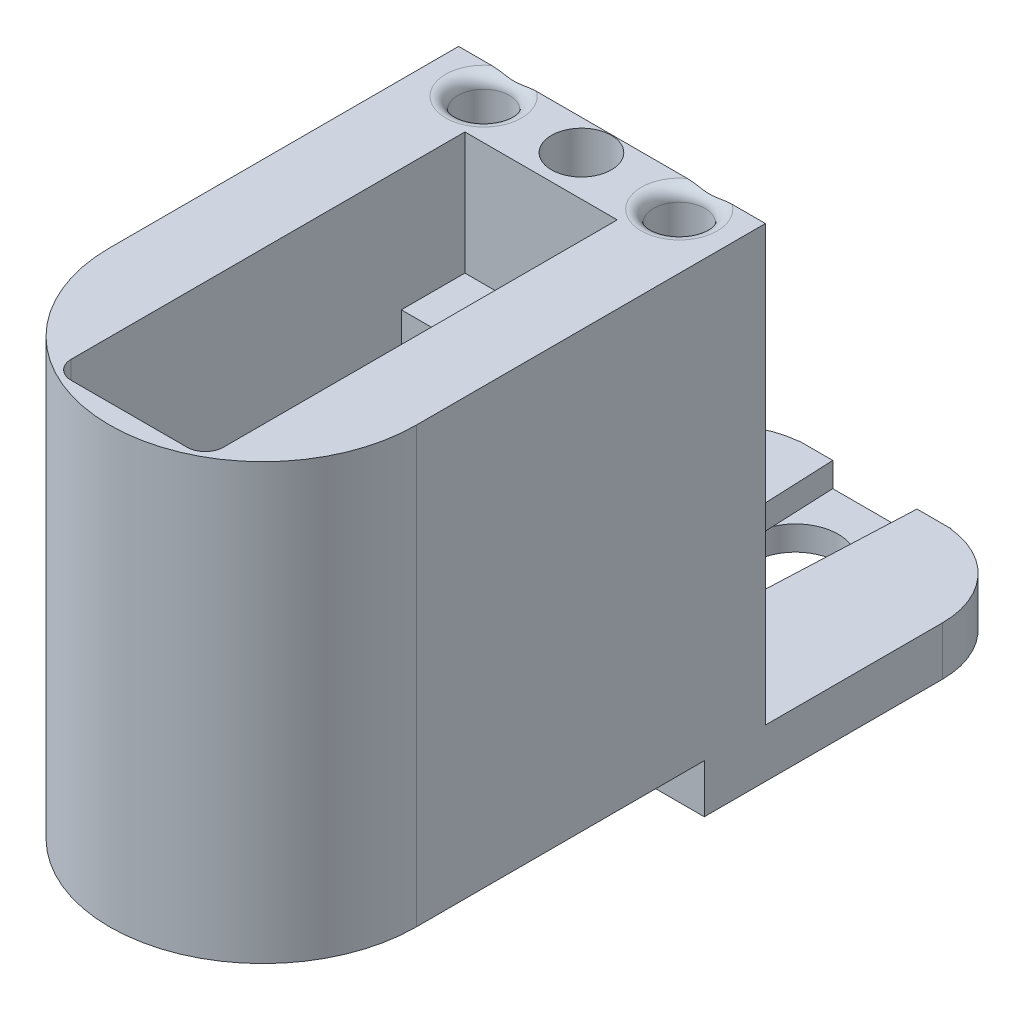
from build123d import *
from OCP.BRepFilletAPI import BRepFilletAPI_MakeChamfer

# Parameters (mm, degrees)
SKETCH4_W                = 12.46
SKETCH4_H                = 17.25
BOSS_EXTRUDE3_DEPTH      = 6
BOSS_EXTRUDE6_DEPTH      = 8.3
BOSS_EXTRUDE6_DEPTH_BACK = 17.25
SKETCH8_R                = 12.546781182
SKETCH8_R_2              = 11.15
BOSS_EXTRUDE4_DEPTH      = 17.25
SKETCH6_R                = 0.75
CUT_EXTRUDE1_DEPTH       = 5
CHAMFER1_SIZE            = 0.5
CHAMFER1_SIZE2           = 0.866025404
SKETCH10_W               = 12.46
SKETCH10_H               = 23.7
CUT_EXTRUDE3_DEPTH       = 17.25
BOSS_EXTRUDE7_START      = -8.3
BOSS_EXTRUDE7_DEPTH      = 8.3
BOSS_EXTRUDE9_START      = 10
BOSS_EXTRUDE9_DEPTH      = 10
BOSS_EXTRUDE11_START     = -8.3
SKETCH20_R               = 11.15
SKETCH20_R_2             = 7.15
BOSS_EXTRUDE11_DEPTH     = 8.3
CUT_EXTRUDE7_START       = -1.3
SKETCH21_R               = 10.15
SKETCH21_R_2             = 7.15
CUT_EXTRUDE7_DEPTH       = 1.3
CUT_EXTRUDE4_REACH       = 39.061
SKETCH11_W               = 10
SKETCH11_H               = 2
CUT_EXTRUDE8_REACH       = 54.194
SKETCH24_W               = 12.46
SKETCH24_H               = 6
BOSS_EXTRUDE10_DEPTH     = 25.093562364
SKETCH18_W               = 21.5
SKETCH18_H               = 12.438292938
CUT_EXTRUDE5_DEPTH       = 2
CUT_EXTRUDE6_DEPTH       = 58.154608998
CUT_EXTRUDE6_DEPTH_BACK  = 58.154608998
SKETCH19_R               = 3.5
FILLET1_R                = 7
SKETCH22_R               = 6.5
BOSS_EXTRUDE12_DEPTH     = 5
SKETCH23_R               = 6.075
BOSS_EXTRUDE13_DEPTH     = 5
FILLET2_R                = 1
BOSS_EXTRUDE15_DEPTH     = 2
CUT_EXTRUDE9_REACH       = 60.657
SKETCH26_R               = 0.75
CUT_EXTRUDE10_DEPTH      = 50.271969555
SKETCH28_R               = 2.1
SKETCH28_R_2             = 2.45
CUT_EXTRUDE11_DEPTH      = 7
FILLET3_R                = 1


with BuildPart() as part:
    # Sketch4 → Boss-Extrude3 (new body)
    with BuildSketch(Plane.XY):
        with Locations((0, -1.35)):
            Rectangle(SKETCH4_W, SKETCH4_H)
    extrude(amount=BOSS_EXTRUDE3_DEPTH)



with BuildPart() as body_2:
    # Sketch8 → Boss-Extrude6 (new, two sides: drawn at the far end of the back side and taken through both)
    with BuildSketch(Plane(origin=(0, -9.975, 0), x_dir=(-1, 0, 0), z_dir=(0, -1, 0)).offset(-BOSS_EXTRUDE6_DEPTH_BACK)):
        with Locations(Location((0, -23.55, 0), (0, 0, 90))):
            Circle(SKETCH8_R)
        with Locations(Location((0, -23.55, 0), (0, 0, 90))):
            Circle(SKETCH8_R_2, mode=Mode.SUBTRACT)
    extrude(amount=BOSS_EXTRUDE6_DEPTH + BOSS_EXTRUDE6_DEPTH_BACK)


with BuildPart() as part_1:
    add(part.part)

    add(body_2.part)  # Boss-Extrude4 merges body 2
    # Sketch5 → Boss-Extrude4 (add)
    with BuildSketch(Plane(origin=(0, 7.275, 0), x_dir=(1, 0, 0), z_dir=(0, 1, 0))):
        with BuildLine():
            Line((12.546781182, -23.55), (12.546781182, 0))
            Line((12.546781182, 0), (6.23, 0))
            Line((6.23, 0), (6.23, -29.7))
            Line((6.23, -29.7), (-6.23, -29.7))
            Line((-6.23, -29.7), (-6.23, 0))
            Line((-6.23, 0), (-12.546781182, 0))
            Line((-12.546781182, 0), (-12.546781182, -23.55))
            ThreePointArc((-12.546781182, -23.55), (0, -36.096781182), (12.546781182, -23.55))
        make_face()
    extrude(amount=-BOSS_EXTRUDE4_DEPTH)

    # Sketch6 → Cut-Extrude1 (cut)
    with BuildSketch(Plane(origin=(0, 7.275, 0), x_dir=(1, 0, 0), z_dir=(0, 1, 0))):
        with Locations(Location((0, -3.6, 0), (0, 0, 270))):
            Circle(SKETCH6_R)
        with Locations(Location((0, -32.1, 0), (0, 0, 270))):
            Circle(SKETCH6_R)
    extrude(amount=-CUT_EXTRUDE1_DEPTH, mode=Mode.SUBTRACT)

    # Chamfer1: one chamfer whose edges measure the first distance from different faces: ONE call of the kernel's chamfer builder (chamfer() names one face for all edges)
    chamfer1_edges_1 = [part_1.edges().sort_by_distance(p)[0] for p in [
        (0, 7.275, 2.85),
    ]]
    chamfer1_side_1 = [part_1.faces().sort_by_distance(p)[0] for p in [
        (12.202646125, 7.275, 11.775),
    ]]
    chamfer1_edges_2 = [part_1.edges().sort_by_distance(p)[0] for p in [
        (0, 7.275, 31.35),
    ]]
    chamfer1_side_2 = [part_1.faces().sort_by_distance(p)[0] for p in [
        (6.532214051, 7.275, 22.001429951),
    ]]
    chamfer1 = BRepFilletAPI_MakeChamfer(part_1.part.solid().wrapped)
    for e in chamfer1_edges_1:
        chamfer1.Add(CHAMFER1_SIZE, CHAMFER1_SIZE2, e.wrapped, chamfer1_side_1[0].wrapped)  # the first distance lies on this face
    for e in chamfer1_edges_2:
        chamfer1.Add(CHAMFER1_SIZE, CHAMFER1_SIZE2, e.wrapped, chamfer1_side_2[0].wrapped)  # the first distance lies on this face
    add(Compound.cast(chamfer1.Shape()), mode=Mode.REPLACE)

    # Sketch10 → Cut-Extrude3 (cut)
    with BuildSketch(Plane(origin=(0, 7.275, 0), x_dir=(1, 0, 0), z_dir=(0, 1, 0))):
        with Locations((0, -17.85)):
            Rectangle(SKETCH10_W, SKETCH10_H)
    extrude(amount=-CUT_EXTRUDE3_DEPTH, mode=Mode.SUBTRACT)

    # Sketch13 → Boss-Extrude7 (add)
    with BuildSketch(Plane.XZ.offset(18.275).offset(BOSS_EXTRUDE7_START)):
        with BuildLine():
            Line((-12.546781182, 23.55), (-12.546781182, 0))
            Line((-12.546781182, 0), (12.546781182, 0))
            Line((12.546781182, 0), (12.546781182, 23.55))
            ThreePointArc((12.546781182, 23.55), (0, 11.003218818), (-12.546781182, 23.55))
        make_face()
    extrude(amount=BOSS_EXTRUDE7_DEPTH)

    # Sketch15 → Boss-Extrude9 (add)
    with BuildSketch(Plane(origin=(0, 7.275, 0), x_dir=(1, 0, 0), z_dir=(0, 1, 0)).offset(BOSS_EXTRUDE9_START)):
        with BuildLine():
            Line((-12.546781182, 0), (12.546781182, 0))
            Line((12.546781182, 0), (12.546781182, -23.55))
            ThreePointArc((12.546781182, -23.55), (0, -36.096781182), (-12.546781182, -23.55))
            Line((-12.546781182, -23.55), (-12.546781182, 0))
        make_face()
        with BuildLine():
            Line((-6.23, -0.8), (6.23, -0.8))
            Line((6.23, -0.8), (6.23, -33))
            ThreePointArc((6.23, -33), (5.790660172, -34.060660172), (4.73, -34.5))
            Line((4.73, -34.5), (-4.73, -34.5))
            ThreePointArc((-4.73, -34.5), (-5.790660172, -34.060660172), (-6.23, -33))
            Line((-6.23, -33), (-6.23, -0.8))
        make_face(mode=Mode.SUBTRACT)
    extrude(amount=-BOSS_EXTRUDE9_DEPTH)

    # Sketch20 → Boss-Extrude11 (add)
    with BuildSketch(Plane.XZ.offset(18.275).offset(BOSS_EXTRUDE11_START)):
        with Locations((0, 23.55)):
            Circle(SKETCH20_R)
        with Locations(Location((0, 23.55, 0), (0, 0, 270))):
            Circle(SKETCH20_R_2, mode=Mode.SUBTRACT)
    extrude(amount=BOSS_EXTRUDE11_DEPTH)

    # Sketch21 → Cut-Extrude7 (cut)
    with BuildSketch(Plane.XZ.offset(18.275).offset(CUT_EXTRUDE7_START)):
        with Locations(Location((0, 23.55, 0), (0, 0, 270))):
            Circle(SKETCH21_R)
        with Locations(Location((0, 23.55, 0), (0, 0, 270))):
            Circle(SKETCH21_R_2, mode=Mode.SUBTRACT)
    extrude(amount=CUT_EXTRUDE7_DEPTH, mode=Mode.SUBTRACT)

    # Cut-Extrude4: up to this face of the body (flat: up to its plane)
    cut_extrude4_end = Plane(part_1.part.faces().sort_by_distance((0, -1.35, 6))[0])
    # Sketch11 → Cut-Extrude4 (cut, up to the picked face)
    with BuildSketch(Plane.XY.offset(29.7), mode=Mode.PRIVATE) as cut_extrude4_sk1:
        with Locations((0, -10.975)):
            Rectangle(SKETCH11_W, SKETCH11_H)
    cut_extrude4_tool1 = split(extrude(cut_extrude4_sk1.sketch, amount=-CUT_EXTRUDE4_REACH, mode=Mode.PRIVATE), bisect_by=cut_extrude4_end, keep=Keep.BOTH, mode=Mode.PRIVATE)
    add(cut_extrude4_tool1.solids().sort_by(Axis((0, -10.975, 29.7), (0, 0, -1)))[0], mode=Mode.SUBTRACT)

    # Sketch24 → Cut-Extrude8 (cut, up to next)
    with BuildSketch(Plane.XZ.offset(18.275), mode=Mode.PRIVATE) as cut_extrude8_sk1:
        with Locations((0, 9)):
            Rectangle(SKETCH24_W, SKETCH24_H)
    cut_extrude8_tool1 = extrude(cut_extrude8_sk1.sketch, amount=-CUT_EXTRUDE8_REACH, mode=Mode.PRIVATE) & part_1.part
    add(cut_extrude8_tool1.solids().sort_by_distance((0, -18.275, 9))[0], mode=Mode.SUBTRACT)

    # Sketch17 → Boss-Extrude10 (add)
    with BuildSketch(Plane(origin=(-12.546781182, 4.728218818, 0), x_dir=(0, -1, 0), z_dir=(1, 0, 0))):
        Polygon((26.978218818, 26.5), (26.978218818, 0), (-17.521781182, 0), (-17.521781182, 26.5), (-13.521781182, 26.5), (-13.521781182, 5), (22.978218818, 5), (22.978218818, 26.5), align=None)
    extrude(amount=BOSS_EXTRUDE10_DEPTH)

    # Sketch18 → Cut-Extrude5 (cut)
    with BuildSketch(Plane.ZX.offset(-18.25)):
        with Locations((-15.75, 0)):
            Rectangle(SKETCH18_W, SKETCH18_H)
    extrude(amount=-CUT_EXTRUDE5_DEPTH, mode=Mode.SUBTRACT)

    # Sketch19 → Cut-Extrude6 (cut, two sides: drawn at the far end of the back side and taken through both)
    with BuildSketch(Plane.ZX.offset(-20.25).offset(-CUT_EXTRUDE6_DEPTH_BACK)):
        with Locations((-20, 0)):
            Circle(SKETCH19_R)
    extrude(amount=CUT_EXTRUDE6_DEPTH + CUT_EXTRUDE6_DEPTH_BACK, mode=Mode.SUBTRACT)

    # Fillet1
    fillet1_edges = [part_1.edges().sort_by_distance(p)[0] for p in [
        (12.546781182, -20.25, -26.5),
        (-12.546781182, -20.25, -26.5),
        (12.546781182, 20.25, -26.5),
        (-12.546781182, 20.25, -26.5),
    ]]
    fillet(fillet1_edges, radius=FILLET1_R)

    # Sketch22 → Boss-Extrude12 (add)
    with BuildSketch(Plane(origin=(0, 22.25, 0), x_dir=(1, 0, 0), z_dir=(0, 1, 0))):
        with Locations(Location((0, 20, 0), (0, 0, 270))):
            Circle(SKETCH22_R)
    extrude(amount=-BOSS_EXTRUDE12_DEPTH)

    # Sketch23 → Boss-Extrude13 (add)
    with BuildSketch(Plane.XZ.offset(-17.25)):
        with Locations(Location((0, -20, 0), (0, 0, 270))):
            Circle(SKETCH23_R)
    extrude(amount=BOSS_EXTRUDE13_DEPTH)

    # Fillet2
    fillet2_edges = [part_1.edges().sort_by_distance(p)[0] for p in [
        (0, 12.25, -13.925),
    ]]
    fillet(fillet2_edges, radius=FILLET2_R)

    # Sketch25 → Boss-Extrude15 (add)
    with BuildSketch(Plane(origin=(0, -20.25, 0), x_dir=(1, 0, 0), z_dir=(0, 1, 0))):
        Polygon((-6.219146469, 5), (-2.5, 5), (-3.1585, 20), (-3.44385, 26.5), (-6.219146469, 26.5), align=None)
        Polygon((6.219146469, 5), (2.5, 5), (3.1585, 20), (3.44385, 26.5), (6.219146469, 26.5), align=None)
    extrude(amount=BOSS_EXTRUDE15_DEPTH)

    # Sketch26 → Cut-Extrude9 (cut, up to next)
    with BuildSketch(Plane(origin=(0, -22.25, 0), x_dir=(-1, 0, 0), z_dir=(0, -1, 0)), mode=Mode.PRIVATE) as cut_extrude9_sk1:
        with Locations(Location((0, 10, 0), (0, 0, 90))):
            Circle(SKETCH26_R)
    cut_extrude9_tool1 = extrude(cut_extrude9_sk1.sketch, amount=-CUT_EXTRUDE9_REACH, mode=Mode.PRIVATE) & part_1.part
    # Sketch26 → Cut-Extrude9 (cut, up to next)
    with BuildSketch(Plane(origin=(0, -22.25, 0), x_dir=(-1, 0, 0), z_dir=(0, -1, 0)), mode=Mode.PRIVATE) as cut_extrude9_sk2:
        with Locations(Location((0, 13, 0), (0, 0, 90))):
            Circle(SKETCH26_R)
    cut_extrude9_tool2 = extrude(cut_extrude9_sk2.sketch, amount=-CUT_EXTRUDE9_REACH, mode=Mode.PRIVATE) & part_1.part
    # Sketch26 → Cut-Extrude9 (cut, up to next)
    with BuildSketch(Plane(origin=(0, -22.25, 0), x_dir=(-1, 0, 0), z_dir=(0, -1, 0)), mode=Mode.PRIVATE) as cut_extrude9_sk3:
        with Locations(Location((0, 7.5, 0), (0, 0, 90))):
            Circle(SKETCH26_R)
    cut_extrude9_tool3 = extrude(cut_extrude9_sk3.sketch, amount=-CUT_EXTRUDE9_REACH, mode=Mode.PRIVATE) & part_1.part
    add(cut_extrude9_tool1.solids().sort_by_distance((0, -22.25, -10))[0], mode=Mode.SUBTRACT)
    add(cut_extrude9_tool2.solids().sort_by_distance((0, -22.25, -13))[0], mode=Mode.SUBTRACT)
    add(cut_extrude9_tool3.solids().sort_by_distance((0, -22.25, -7.5))[0], mode=Mode.SUBTRACT)

    # Sketch27 → Cut-Extrude10 (cut, through all)
    with BuildSketch(Plane.ZY.offset(12.546781182)):
        Polygon((-26.5, 22.25), (0, 22.25), (0, 17.275), (-10.361855954, 17.275), (-10.361855954, 7.850012942), (-26.5, 7.850012942), align=None)
    extrude(amount=-CUT_EXTRUDE10_DEPTH, mode=Mode.SUBTRACT)

    # Sketch28 → Cut-Extrude11 (cut)
    with BuildSketch(Plane(origin=(0, 17.275, 0), x_dir=(1, 0, 0), z_dir=(0, 1, 0))):
        with Locations(Location((-8, 2.5, 0), (0, 0, 270))):
            Circle(SKETCH28_R)
        with Locations(Location((8, 2.5, 0), (0, 0, 270))):
            Circle(SKETCH28_R)
        with Locations(Location((0, 2.5, 0), (0, 0, 270))):
            Circle(SKETCH28_R_2)
    extrude(amount=-CUT_EXTRUDE11_DEPTH, mode=Mode.SUBTRACT)

    # Fillet3
    # the kernel refuses this fillet: 1 mm, written as the material it takes off along each edge
    with BuildSketch(Plane(origin=(-8, 17.275, -2.5), x_dir=(0, 0, 1), z_dir=(-1, 0, 0))) as fillet3_piece_1:
        with BuildLine():
            CenterArc((2.1 + FILLET3_R, -FILLET3_R), FILLET3_R, 90, 90)
            Line((2.1, -FILLET3_R), (2.1, 0))
            Line((2.1, 0), (2.1 + FILLET3_R, 0))
        make_face()
    revolve(axis=Axis((-8, 17.275, -2.5), (0, 1, 0)), mode=Mode.SUBTRACT)
    with BuildSketch(Plane(origin=(8, 17.275, -2.5), x_dir=(0, 0, 1), z_dir=(-1, 0, 0))) as fillet3_piece_2:
        with BuildLine():
            CenterArc((2.1 + FILLET3_R, -FILLET3_R), FILLET3_R, 90, 90)
            Line((2.1, -FILLET3_R), (2.1, 0))
            Line((2.1, 0), (2.1 + FILLET3_R, 0))
        make_face()
    revolve(axis=Axis((8, 17.275, -2.5), (0, 1, 0)), mode=Mode.SUBTRACT)


solid = part_1.part
